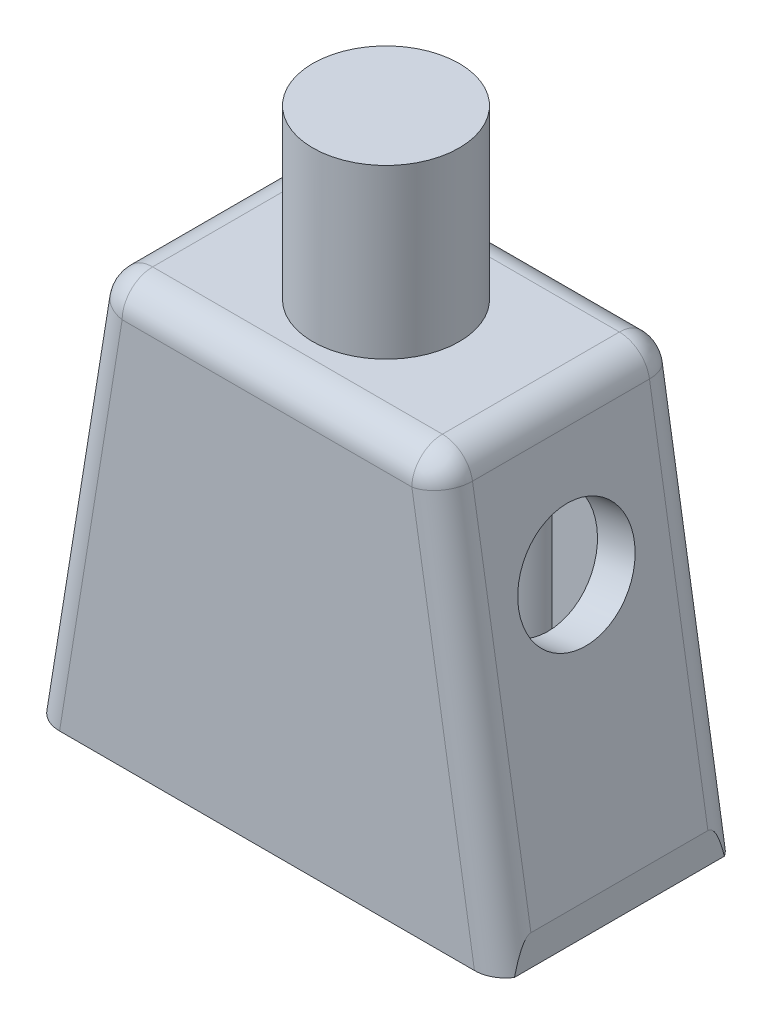
from build123d import *

# Parameters (mm, degrees)
BOSS_EXTRUDE1_DEPTH = 7.8
FILLET1_R           = 1
SKETCH3_R           = 2.4
BOSS_EXTRUDE2_DEPTH = 5.5
SHELL3_START        = 1.25
SHELL3_DEPTH        = 5.3
SHELL3_START_2      = 12.45
SHELL3_2_OUTLINE_R  = 1.15
SHELL3_2_DEPTH      = 5.5
SKETCH7_R           = 1.9
CUT_EXTRUDE5_DEPTH  = 2
BOSS_EXTRUDE3_REACH = 24.091


with BuildPart() as part:
    # Sketch2 → Boss-Extrude1 (new body)
    with BuildSketch(Plane.XY):
        Polygon((-7.65, 0), (7.65, 0), (7.65, 1), (5.599872407, 13.7), (2.399872407, 13.7), (-2.399872407, 13.7), (-5.599872407, 13.7), (-7.65, 1), align=None)
    extrude(amount=BOSS_EXTRUDE1_DEPTH)

    # Fillet1
    fillet1_edges = [part.edges().sort_by_distance(p)[0] for p in [
        (5.599872407, 13.7, 3.9),
        (0, 13.7, 7.8),
        (-5.599872407, 13.7, 3.9),
        (0, 13.7, 0),
        (6.624936203, 7.35, 0),
        (6.624936203, 7.35, 7.8),
        (-6.624936203, 7.35, 7.8),
        (-6.624936203, 7.35, 0),
    ]]
    fillet(fillet1_edges, radius=FILLET1_R)

    # Sketch3 → Boss-Extrude2 (add)
    with BuildSketch(Plane(origin=(0, 13.7, 0), x_dir=(1, 0, 0), z_dir=(0, 1, 0))):
        with Locations((0, -3.9)):
            Circle(SKETCH3_R)
    extrude(amount=BOSS_EXTRUDE2_DEPTH)

    # Shell3: read off the stored shape, not the designer's step
    # Shell3 outline → Shell3 (cut)
    with BuildSketch(Plane.XY.offset(SHELL3_START)):
        Polygon((6.4, 0), (6.4, 0.899756749), (4.535474615, 12.45), (-4.535474615, 12.45), (-6.4, 0.899756749), (-6.4, 0), align=None)
    extrude(amount=SHELL3_DEPTH, mode=Mode.SUBTRACT)

    # Shell3 2 outline → Shell3 2 (cut)
    with BuildSketch(Plane(origin=(0, 0, 0), x_dir=(1, 0, 0), z_dir=(0, 1, 0)).offset(SHELL3_START_2)):
        with Locations((0, -3.9)):
            Circle(SHELL3_2_OUTLINE_R)
    extrude(amount=SHELL3_2_DEPTH, mode=Mode.SUBTRACT)

    # Sketch7 → Cut-Extrude5 (cut)
    with BuildSketch(Plane(origin=(7.613040698, 1.228953134, 0), x_dir=(0, 0, -1), z_dir=(0.987219843348776, 0.15936430245954794, 0))):
        with Locations(Location((-4, 7.98097386, 0), (0, 0, 90))):
            Circle(SKETCH7_R)
    cut_extrude5 = extrude(amount=-CUT_EXTRUDE5_DEPTH, mode=Mode.SUBTRACT)

    # Mirror1: Cut-Extrude5 across plane
    add(cut_extrude5.mirror(Plane(origin=(0, 0, 0), x_dir=(0, 0, 1), z_dir=(1, 0, 0))), mode=Mode.SUBTRACT)

    # Sketch8 → Boss-Extrude3 (add, up to next)
    with BuildSketch(Plane.XZ, mode=Mode.PRIVATE) as boss_extrude3_sk1:
        with BuildLine():
            Line((1.5, 6.55), (1.5, 5.692944235))
            ThreePointArc((1.5, 5.692944235), (2.274557316, 5.926727718), (2.790430764, 6.55))
            Line((2.790430764, 6.55), (1.5, 6.55))
        make_face()
    boss_extrude3_tool1 = extrude(boss_extrude3_sk1.sketch, amount=-BOSS_EXTRUDE3_REACH, mode=Mode.PRIVATE) - part.part
    # Sketch8 → Boss-Extrude3 (add, up to next)
    with BuildSketch(Plane.XZ, mode=Mode.PRIVATE) as boss_extrude3_sk2:
        with BuildLine():
            Line((-1.5, 6.55), (-1.5, 5.692944235))
            ThreePointArc((-1.5, 5.692944235), (-2.274557316, 5.926727718), (-2.790430764, 6.55))
            Line((-2.790430764, 6.55), (-1.5, 6.55))
        make_face()
    boss_extrude3_tool2 = extrude(boss_extrude3_sk2.sketch, amount=-BOSS_EXTRUDE3_REACH, mode=Mode.PRIVATE) - part.part
    # Sketch8 → Boss-Extrude3 (add, up to next)
    with BuildSketch(Plane.XZ, mode=Mode.PRIVATE) as boss_extrude3_sk3:
        with BuildLine():
            Line((1.5, 1.25), (1.5, 2.107055765))
            ThreePointArc((1.5, 2.107055765), (2.274557316, 1.873272282), (2.790430764, 1.25))
            Line((2.790430764, 1.25), (1.5, 1.25))
        make_face()
    boss_extrude3_tool3 = extrude(boss_extrude3_sk3.sketch, amount=-BOSS_EXTRUDE3_REACH, mode=Mode.PRIVATE) - part.part
    # Sketch8 → Boss-Extrude3 (add, up to next)
    with BuildSketch(Plane.XZ, mode=Mode.PRIVATE) as boss_extrude3_sk4:
        with BuildLine():
            Line((-1.5, 1.25), (-1.5, 2.107055765))
            ThreePointArc((-1.5, 2.107055765), (-2.274557316, 1.873272282), (-2.790430764, 1.25))
            Line((-2.790430764, 1.25), (-1.5, 1.25))
        make_face()
    boss_extrude3_tool4 = extrude(boss_extrude3_sk4.sketch, amount=-BOSS_EXTRUDE3_REACH, mode=Mode.PRIVATE) - part.part
    add(boss_extrude3_tool1.solids().sort_by_distance((2.012361, 0, 6.196212))[0])
    add(boss_extrude3_tool2.solids().sort_by_distance((-2.012361, 0, 6.196212))[0])
    add(boss_extrude3_tool3.solids().sort_by_distance((2.012361, 0, 1.603788))[0])
    add(boss_extrude3_tool4.solids().sort_by_distance((-2.012361, 0, 1.603788))[0])


solid = part.part
